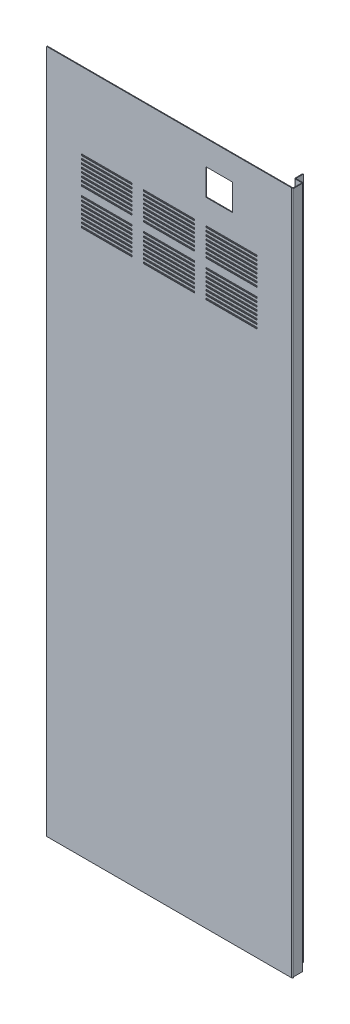
from build123d import *

# Parameters (mm, degrees)
BRIDA_BASE2_DEPTH          = 1810
CORTAR_EXTRUIR1_DEPTH      = 1924.746243661
CORTAR_EXTRUIR1_DEPTH_BACK = 1924.746243661
CROQUIS5_W                 = 58.064635051
CROQUIS5_H                 = 1.9
CROQUIS5_W_2               = 52.43677075
CROQUIS11_W                = 134.8
CROQUIS11_H                = 4
CORTAR_EXTRUIR2_DEPTH      = 1924.152373058
MATRIZL1_COUNT             = 8
MATRIZL1_PITCH             = 10
MATRIZL2_COUNT             = 2
MATRIZL2_PITCH             = 95.4
MATRIZL2_COPY_1_SKETCH_W   = 134.8
MATRIZL2_COPY_1_SKETCH_H   = 4
MATRIZL2_COPY_1_DEPTH      = 1924.152373058
MATRIZL2_COPY_2_SKETCH_W   = 134.8
MATRIZL2_COPY_2_SKETCH_H   = 4
MATRIZL2_COPY_2_DEPTH      = 1924.152373058
MATRIZL2_COPY_3_SKETCH_W   = 134.8
MATRIZL2_COPY_3_SKETCH_H   = 4
MATRIZL2_COPY_3_DEPTH      = 1924.152373058
MATRIZL2_COPY_4_SKETCH_W   = 134.8
MATRIZL2_COPY_4_SKETCH_H   = 4
MATRIZL2_COPY_4_DEPTH      = 1924.152373058
MATRIZL2_COPY_5_SKETCH_W   = 134.8
MATRIZL2_COPY_5_SKETCH_H   = 4
MATRIZL2_COPY_5_DEPTH      = 1924.152373058
MATRIZL2_COPY_6_SKETCH_W   = 134.8
MATRIZL2_COPY_6_SKETCH_H   = 4
MATRIZL2_COPY_6_DEPTH      = 1924.152373058
MATRIZL2_COPY_7_SKETCH_W   = 134.8
MATRIZL2_COPY_7_SKETCH_H   = 4
MATRIZL2_COPY_7_DEPTH      = 1924.152373058
CORTAR_EXTRUIR3_DEPTH      = 1924.152373058
CORTAR_EXTRUIR3_DEPTH_BACK = 1924.152373058
CROQUIS12_W                = 70
CROQUIS12_H                = 70


# Sheet-metal steps are written as plain solids
with BuildPart() as part:
    # Croquis4 → Brida base2 (new body)
    with BuildSketch(Plane(origin=(0, 0, 0), x_dir=(1, 0, 0), z_dir=(0, 1, 0))):
        with BuildLine():
            Line((-648.1, 0), (-0.7366, 0))
            ThreePointArc((-0.7366, 0), (-0.215745145, 0.215745145), (0, 0.7366))
            Line((0, 0.7366), (0, 24.2634))
            ThreePointArc((0, 24.2634), (-0.215745145, 24.784254855), (-0.7366, 25))
            Line((-0.7366, 25), (-17.3634, 25))
            ThreePointArc((-17.3634, 25), (-19.227757739, 25.772242261), (-20, 27.6366))
            Line((-20, 27.6366), (-20, 46.9))
            Line((-20, 46.9), (-18.1, 46.9))
            Line((-18.1, 46.9), (-18.1, 27.6366))
            ThreePointArc((-18.1, 27.6366), (-17.884254855, 27.115745145), (-17.3634, 26.9))
            Line((-17.3634, 26.9), (-0.7366, 26.9))
            ThreePointArc((-0.7366, 26.9), (1.127757739, 26.127757739), (1.9, 24.2634))
            Line((1.9, 24.2634), (1.9, 0.7366))
            ThreePointArc((1.9, 0.7366), (1.127757739, -1.127757739), (-0.7366, -1.9))
            Line((-0.7366, -1.9), (-648.1, -1.9))
            Line((-648.1, -1.9), (-648.1, 0))
        make_face()
    extrude(amount=BRIDA_BASE2_DEPTH)

    # Croquis5 → Cortar-Extruir1 (cut, two sides: drawn at the far end of the back side and taken through both)
    with BuildSketch(Plane(origin=(1.9, 0, 0), x_dir=(0, 0, -1), z_dir=(1, 0, 0)).offset(-CORTAR_EXTRUIR1_DEPTH_BACK)):
        with Locations((29.768917526, 1809.05)):
            Rectangle(CROQUIS5_W, CROQUIS5_H)
        with Locations((26.954985375, 0.95)):
            Rectangle(CROQUIS5_W_2, CROQUIS5_H)
    extrude(amount=CORTAR_EXTRUIR1_DEPTH + CORTAR_EXTRUIR1_DEPTH_BACK, mode=Mode.SUBTRACT)

    # Croquis11 → Cortar-Extruir2 (cut, symmetric)
    with BuildSketch(Plane.XY.offset(1.9)):
        with Locations((-489.2183, 1608)):
            Rectangle(CROQUIS11_W, CROQUIS11_H)
        with Locations((-324.4183, 1608)):
            Rectangle(CROQUIS11_W, CROQUIS11_H)
        with Locations((-159.6183, 1608)):
            Rectangle(CROQUIS11_W, CROQUIS11_H)
    cortar_extruir2 = extrude(amount=CORTAR_EXTRUIR2_DEPTH, both=True, mode=Mode.SUBTRACT)

    # MatrizL1: Cortar-Extruir2 ×8
    with Locations(*[(0, -i * MATRIZL1_PITCH, 0) for i in range(1, MATRIZL1_COUNT)]):
        add(cortar_extruir2, mode=Mode.SUBTRACT)

    # MatrizL2: Cortar-Extruir2 ×2
    with Locations(*[(0, -i * MATRIZL2_PITCH, 0) for i in range(1, MATRIZL2_COUNT)]):
        add(cortar_extruir2, mode=Mode.SUBTRACT)

    # MatrizL2 copy 1 sketch → MatrizL2 copy 1 (cut, symmetric)
    with BuildSketch(Plane(origin=(0, -105.4, 1.9), x_dir=(1, 0, 0), z_dir=(0, 0, 1))):
        with Locations((-489.2183, 1608)):
            Rectangle(MATRIZL2_COPY_1_SKETCH_W, MATRIZL2_COPY_1_SKETCH_H)
        with Locations((-324.4183, 1608)):
            Rectangle(MATRIZL2_COPY_1_SKETCH_W, MATRIZL2_COPY_1_SKETCH_H)
        with Locations((-159.6183, 1608)):
            Rectangle(MATRIZL2_COPY_1_SKETCH_W, MATRIZL2_COPY_1_SKETCH_H)
    extrude(amount=MATRIZL2_COPY_1_DEPTH, both=True, mode=Mode.SUBTRACT)

    # MatrizL2 copy 2 sketch → MatrizL2 copy 2 (cut, symmetric)
    with BuildSketch(Plane(origin=(0, -115.4, 1.9), x_dir=(1, 0, 0), z_dir=(0, 0, 1))):
        with Locations((-489.2183, 1608)):
            Rectangle(MATRIZL2_COPY_2_SKETCH_W, MATRIZL2_COPY_2_SKETCH_H)
        with Locations((-324.4183, 1608)):
            Rectangle(MATRIZL2_COPY_2_SKETCH_W, MATRIZL2_COPY_2_SKETCH_H)
        with Locations((-159.6183, 1608)):
            Rectangle(MATRIZL2_COPY_2_SKETCH_W, MATRIZL2_COPY_2_SKETCH_H)
    extrude(amount=MATRIZL2_COPY_2_DEPTH, both=True, mode=Mode.SUBTRACT)

    # MatrizL2 copy 3 sketch → MatrizL2 copy 3 (cut, symmetric)
    with BuildSketch(Plane(origin=(0, -125.4, 1.9), x_dir=(1, 0, 0), z_dir=(0, 0, 1))):
        with Locations((-489.2183, 1608)):
            Rectangle(MATRIZL2_COPY_3_SKETCH_W, MATRIZL2_COPY_3_SKETCH_H)
        with Locations((-324.4183, 1608)):
            Rectangle(MATRIZL2_COPY_3_SKETCH_W, MATRIZL2_COPY_3_SKETCH_H)
        with Locations((-159.6183, 1608)):
            Rectangle(MATRIZL2_COPY_3_SKETCH_W, MATRIZL2_COPY_3_SKETCH_H)
    extrude(amount=MATRIZL2_COPY_3_DEPTH, both=True, mode=Mode.SUBTRACT)

    # MatrizL2 copy 4 sketch → MatrizL2 copy 4 (cut, symmetric)
    with BuildSketch(Plane(origin=(0, -135.4, 1.9), x_dir=(1, 0, 0), z_dir=(0, 0, 1))):
        with Locations((-489.2183, 1608)):
            Rectangle(MATRIZL2_COPY_4_SKETCH_W, MATRIZL2_COPY_4_SKETCH_H)
        with Locations((-324.4183, 1608)):
            Rectangle(MATRIZL2_COPY_4_SKETCH_W, MATRIZL2_COPY_4_SKETCH_H)
        with Locations((-159.6183, 1608)):
            Rectangle(MATRIZL2_COPY_4_SKETCH_W, MATRIZL2_COPY_4_SKETCH_H)
    extrude(amount=MATRIZL2_COPY_4_DEPTH, both=True, mode=Mode.SUBTRACT)

    # MatrizL2 copy 5 sketch → MatrizL2 copy 5 (cut, symmetric)
    with BuildSketch(Plane(origin=(0, -145.4, 1.9), x_dir=(1, 0, 0), z_dir=(0, 0, 1))):
        with Locations((-489.2183, 1608)):
            Rectangle(MATRIZL2_COPY_5_SKETCH_W, MATRIZL2_COPY_5_SKETCH_H)
        with Locations((-324.4183, 1608)):
            Rectangle(MATRIZL2_COPY_5_SKETCH_W, MATRIZL2_COPY_5_SKETCH_H)
        with Locations((-159.6183, 1608)):
            Rectangle(MATRIZL2_COPY_5_SKETCH_W, MATRIZL2_COPY_5_SKETCH_H)
    extrude(amount=MATRIZL2_COPY_5_DEPTH, both=True, mode=Mode.SUBTRACT)

    # MatrizL2 copy 6 sketch → MatrizL2 copy 6 (cut, symmetric)
    with BuildSketch(Plane(origin=(0, -155.4, 1.9), x_dir=(1, 0, 0), z_dir=(0, 0, 1))):
        with Locations((-489.2183, 1608)):
            Rectangle(MATRIZL2_COPY_6_SKETCH_W, MATRIZL2_COPY_6_SKETCH_H)
        with Locations((-324.4183, 1608)):
            Rectangle(MATRIZL2_COPY_6_SKETCH_W, MATRIZL2_COPY_6_SKETCH_H)
        with Locations((-159.6183, 1608)):
            Rectangle(MATRIZL2_COPY_6_SKETCH_W, MATRIZL2_COPY_6_SKETCH_H)
    extrude(amount=MATRIZL2_COPY_6_DEPTH, both=True, mode=Mode.SUBTRACT)

    # MatrizL2 copy 7 sketch → MatrizL2 copy 7 (cut, symmetric)
    with BuildSketch(Plane(origin=(0, -165.4, 1.9), x_dir=(1, 0, 0), z_dir=(0, 0, 1))):
        with Locations((-489.2183, 1608)):
            Rectangle(MATRIZL2_COPY_7_SKETCH_W, MATRIZL2_COPY_7_SKETCH_H)
        with Locations((-324.4183, 1608)):
            Rectangle(MATRIZL2_COPY_7_SKETCH_W, MATRIZL2_COPY_7_SKETCH_H)
        with Locations((-159.6183, 1608)):
            Rectangle(MATRIZL2_COPY_7_SKETCH_W, MATRIZL2_COPY_7_SKETCH_H)
    extrude(amount=MATRIZL2_COPY_7_DEPTH, both=True, mode=Mode.SUBTRACT)

    # Croquis12 → Cortar-Extruir3 (cut, two sides: drawn at the far end of the back side and taken through both)
    with BuildSketch(Plane.XY.offset(1.9).offset(-CORTAR_EXTRUIR3_DEPTH_BACK)):
        with Locations((-192.0183, 1710)):
            Rectangle(CROQUIS12_W, CROQUIS12_H)
    extrude(amount=CORTAR_EXTRUIR3_DEPTH + CORTAR_EXTRUIR3_DEPTH_BACK, mode=Mode.SUBTRACT)


solid = part.part
